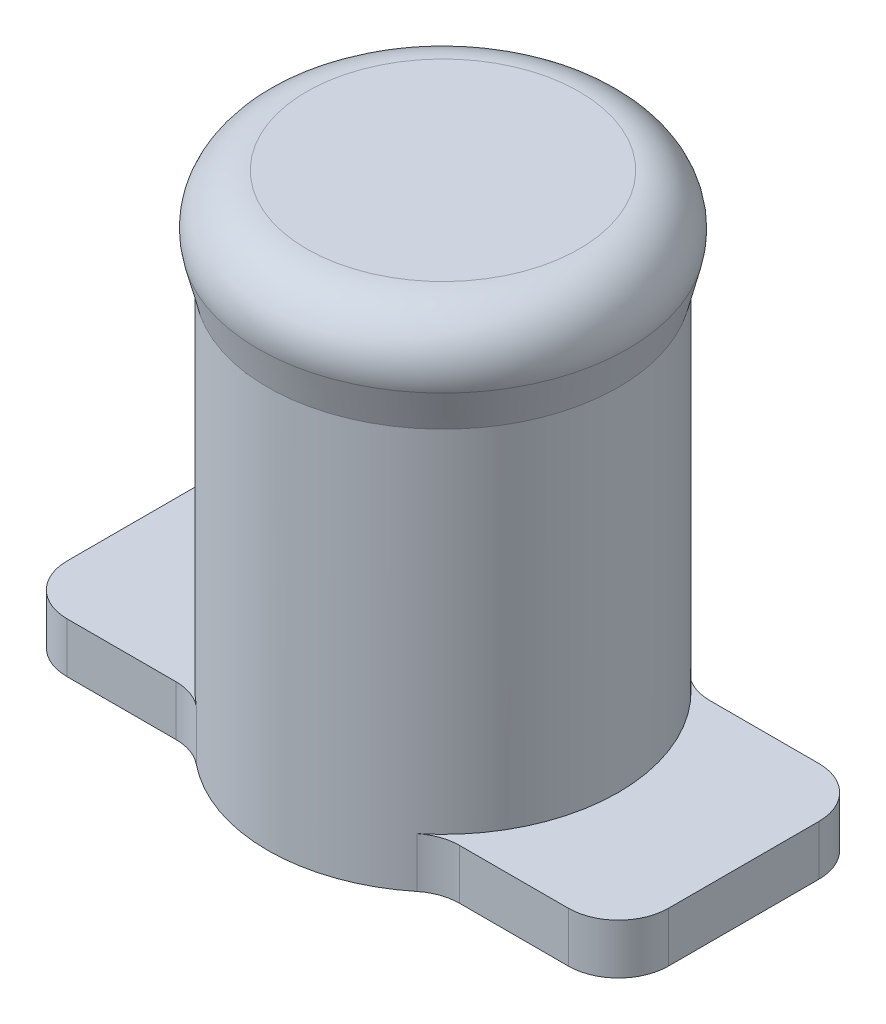
from build123d import *

# Parameters (mm, degrees)
SKETCH3_W           = 3.6
SKETCH3_H           = 3.6
CUT_EXTRUDE2_DEPTH  = 3.5
SKETCH4_W           = 4.2
SKETCH4_H           = 5
BOSS_EXTRUDE1_DEPTH = 1
FILLET1_R           = 1


with BuildPart() as part:
    # Sketch1 → Revolve1 (revolve)
    with BuildSketch(Plane.XY):
        Polygon((0, 0), (0, 10), (4, 10), (3.5, 8), (3.5, 0), align=None)
    revolve(axis=Axis((0, 0, 0), (0, 1, 0)))

    # Sketch3 → Cut-Extrude2 (cut)
    with BuildSketch(Plane.XZ):
        Rectangle(SKETCH3_W, SKETCH3_H)
    extrude(amount=-CUT_EXTRUDE2_DEPTH, mode=Mode.SUBTRACT)

    # Sketch4 → Boss-Extrude1 (add)
    with BuildSketch(Plane(origin=(0, 0, 0), x_dir=(1, 0, 0), z_dir=(0, 1, 0))):
        with Locations((-3.9, 0)):
            Rectangle(SKETCH4_W, SKETCH4_H)
        with Locations((3.9, 0)):
            Rectangle(SKETCH4_W, SKETCH4_H)
    extrude(amount=BOSS_EXTRUDE1_DEPTH)

    # Fillet1
    fillet1_edges = [part.edges().sort_by_distance(p)[0] for p in [
        (2.449489743, 0.5, 2.5),
        (6, 0.5, 2.5),
        (6, 0.5, -2.5),
        (2.449489743, 0.5, -2.5),
        (-2.449489743, 0.5, -2.5),
        (-6, 0.5, -2.5),
        (-6, 0.5, 2.5),
        (-2.449489743, 0.5, 2.5),
        (-4, 10, 0),
    ]]
    fillet(fillet1_edges, radius=FILLET1_R)


solid = part.part
